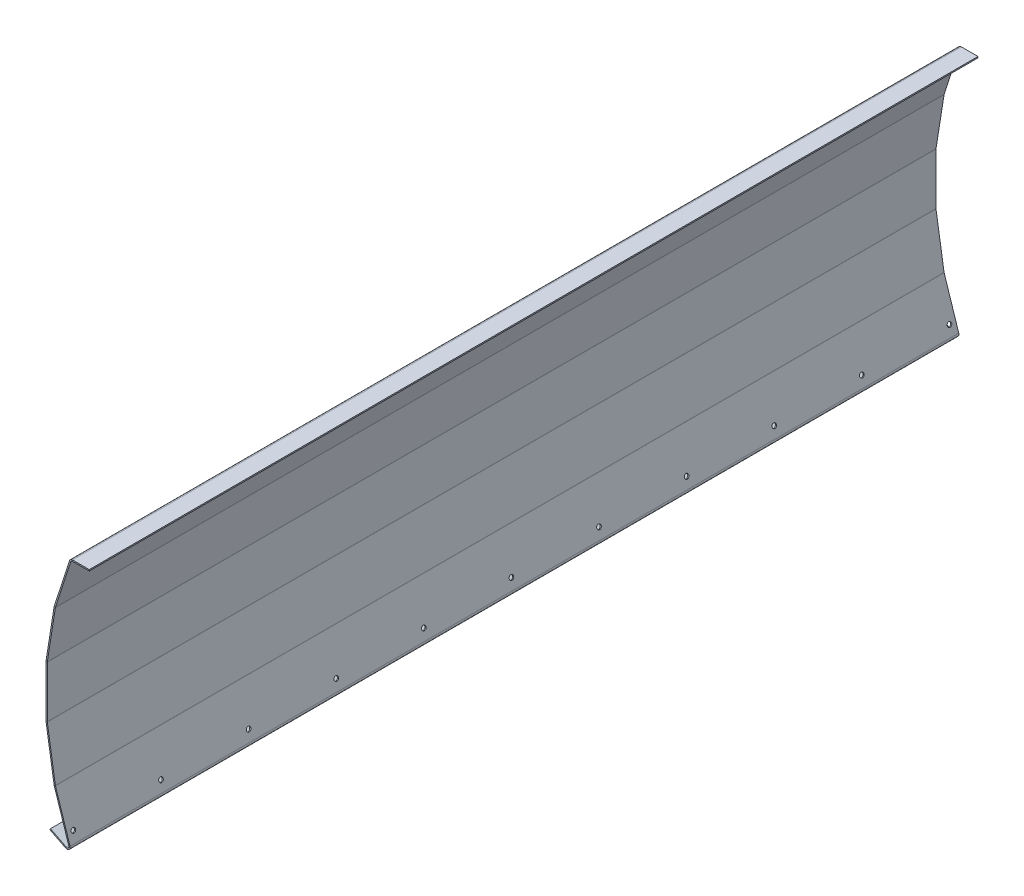
from build123d import *

# Parameters (mm, degrees)
SM_BASE_FLANGE_1_DEPTH = 700
SKETCH_2_R             = 3.5
CUT_EXTRUDE_1_DEPTH    = 5


# Sheet-metal steps are written as plain solids
with BuildPart() as part:
    # Sketch 1 → Базовая кромка1 (new body)
    with BuildSketch(Plane.XY):
        with BuildLine():
            Line((69.782473476, 200), (43.415186116, 200))
            ThreePointArc((43.415186116, 200), (40.476259854, 199.045084972), (38.659903534, 196.545084972))
            Line((38.659903534, 196.545084972), (14.561776314, 122.37867555))
            ThreePointArc((14.561776314, 122.37867555), (14.455209294, 122.000817397), (14.378617193, 121.615762903))
            Line((14.378617193, 121.615762903), (1.672637328, 41.393363285))
            ThreePointArc((1.672637328, 41.393363285), (1.626492362, 41.003486439), (1.611079031, 40.61119096))
            Line((1.611079031, 40.61119096), (1.611079031, -40.61119096))
            ThreePointArc((1.611079031, -40.61119096), (1.626492362, -41.003486439), (1.672637328, -41.393363285))
            Line((1.672637328, -41.393363285), (14.378617193, -121.615762903))
            ThreePointArc((14.378617193, -121.615762903), (14.455209294, -122.000817397), (14.561776314, -122.37867555))
            Line((14.561776314, -122.37867555), (37.544374419, -193.111839379))
            ThreePointArc((37.544374419, -193.111839379), (36.639549016, -196.320108259), (33.329233371, -196.711909935))
            Line((33.329233371, -196.711909935), (8.597245129, -184.110332509))
            Line((8.597245129, -184.110332509), (7.68926413, -185.892345557))
            Line((7.68926413, -185.892345557), (32.421252372, -198.493922983))
            ThreePointArc((32.421252372, -198.493922983), (37.938445112, -197.84092019), (39.446487452, -192.493805391))
            Line((39.446487452, -192.493805391), (16.463889347, -121.760641561))
            ThreePointArc((16.463889347, -121.760641561), (16.399949135, -121.53392667), (16.353993874, -121.302893973))
            Line((16.353993874, -121.302893973), (3.648014009, -41.080494355))
            ThreePointArc((3.648014009, -41.080494355), (3.62032703, -40.846568247), (3.611079031, -40.61119096))
            Line((3.611079031, -40.61119096), (3.611079031, 40.61119096))
            ThreePointArc((3.611079031, 40.61119096), (3.62032703, 40.846568247), (3.648014009, 41.080494355))
            Line((3.648014009, 41.080494355), (16.353993874, 121.302893973))
            ThreePointArc((16.353993874, 121.302893973), (16.399949135, 121.53392667), (16.463889347, 121.760641561))
            Line((16.463889347, 121.760641561), (40.562016567, 195.927050983))
            ThreePointArc((40.562016567, 195.927050983), (41.651830359, 197.427050983), (43.415186116, 198))
            Line((43.415186116, 198), (69.782473476, 198))
            Line((69.782473476, 198), (69.782473476, 200))
        make_face()
    extrude(amount=SM_BASE_FLANGE_1_DEPTH)

    # Зеркальное отражение1: part across plane


with BuildPart() as part_1:
    add(part.part)
    add(part.part.mirror(Plane(origin=(34.691204871, -194.038890362, 0), x_dir=(1, 0, 0), z_dir=(0, 0, 1))))

    # Sketch 2 → Вырез-Вытянуть1 (cut)
    with BuildSketch(Plane(origin=(-20.892826899, -6.788490969, 0), x_dir=(0, 0, -1), z_dir=(0.9510565162951543, 0.3090169943749452, 0))):
        with Locations(Location((-690, -180.2560263, 0), (0, 0, 90))):
            Circle(SKETCH_2_R)
        with Locations(Location((-552, -180.2560263, 0), (0, 0, 90))):
            Circle(SKETCH_2_R)
        with Locations(Location((-414, -180.2560263, 0), (0, 0, 90))):
            Circle(SKETCH_2_R)
        with Locations(Location((-276, -180.2560263, 0), (0, 0, 90))):
            Circle(SKETCH_2_R)
        with Locations(Location((-138, -180.2560263, 0), (0, 0, 90))):
            Circle(SKETCH_2_R)
        with Locations(Location((0, -180.2560263, 0), (0, 0, 90))):
            Circle(SKETCH_2_R)
        with Locations(Location((690, -180.2560263, 0), (0, 0, 90))):
            Circle(SKETCH_2_R)
        with Locations(Location((552, -180.2560263, 0), (0, 0, 90))):
            Circle(SKETCH_2_R)
        with Locations(Location((414, -180.2560263, 0), (0, 0, 90))):
            Circle(SKETCH_2_R)
        with Locations(Location((276, -180.2560263, 0), (0, 0, 90))):
            Circle(SKETCH_2_R)
        with Locations(Location((138, -180.2560263, 0), (0, 0, 90))):
            Circle(SKETCH_2_R)
    extrude(amount=-CUT_EXTRUDE_1_DEPTH, mode=Mode.SUBTRACT)


solid = part_1.part
